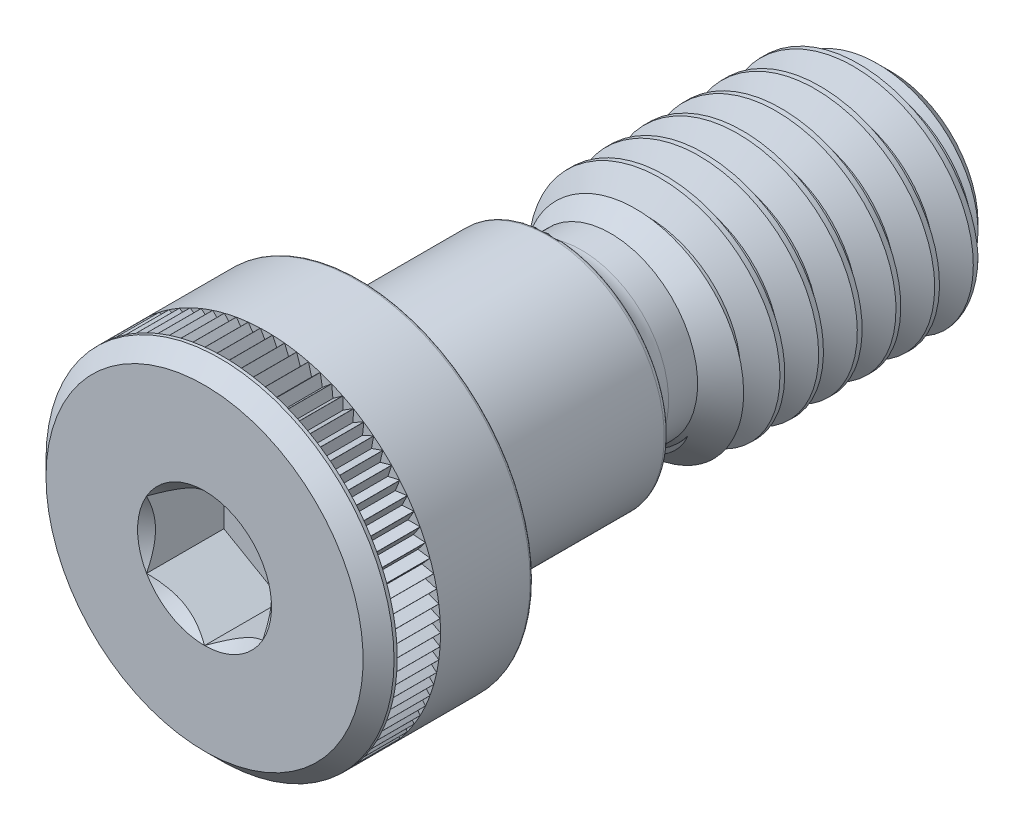
from build123d import *

# Parameters (mm, degrees)
CUT_EXTRUDE2_DEPTH = 3.175
CUT_SWEEP1_PITCH   = 1.5875
CUT_EXTRUDE5_DEPTH = 1.778
CIRPATTERN1_COUNT  = 90


with BuildPart() as part:
    # Sketch12 → Revolve1 (revolve)
    with BuildSketch(Plane(origin=(0, 0, 0), x_dir=(0, 0, -1), z_dir=(1, 0, 0)), mode=Mode.PRIVATE) as revolve1_sk:
        with BuildLine():
            Line((-14.0890625, 0), (-14.0890625, 6.50875))
            Line((-14.0890625, 6.50875), (-13.4540625, 7.14375))
            Line((-13.4540625, 7.14375), (-7.8660625, 7.14375))
            ThreePointArc((-7.8660625, 7.14375), (-7.776259939, 7.106552561), (-7.7390625, 7.01675))
            Line((-7.7390625, 7.01675), (-7.7390625, 4.429125))
            Line((-7.7390625, 4.429125), (-6.9453125, 4.429125))
            Line((-6.9453125, 4.429125), (-6.9453125, 4.572))
            ThreePointArc((-6.9453125, 4.572), (-6.889516342, 4.706703842), (-6.7548125, 4.7625))
            Line((-6.7548125, 4.7625), (0.02113852, 4.7625))
            ThreePointArc((0.02113852, 4.7625), (0.146207897, 4.715693775), (0.209817689, 4.598275862))
            ThreePointArc((0.209817689, 4.598275862), (0.607378892, 3.864413909), (1.3890625, 3.571875))
            Line((1.3890625, 3.571875), (2.5796875, 3.571875))
            Line((2.5796875, 3.571875), (3.7703125, 4.7625))
            Line((3.7703125, 4.7625), (12.8984375, 4.7625))
            Line((12.8984375, 4.7625), (14.0890625, 3.571875))
            Line((14.0890625, 3.571875), (14.0890625, 0))
            Line((14.0890625, 0), (-14.0890625, 0))
        make_face()
    revolve(revolve1_sk.sketch.rotate(Axis((0, 0, -14.0890625), (0, 0, 1)), 90), axis=Axis((0, 0, -14.0890625), (0, 0, 1)))

    # Sketch8 → Cut-Extrude2 (cut)
    with BuildSketch(Plane.XY.offset(14.0890625)):
        Polygon((0, -2.749630657), (2.38125, -1.374815329), (2.38125, 1.374815329), (0, 2.749630657), (-2.38125, 1.374815329), (-2.38125, -1.374815329), align=None)
    extrude(amount=-CUT_EXTRUDE2_DEPTH, mode=Mode.SUBTRACT)

    # Cut-Extrude4 cone 1 section (through the dimple's axis) → Cut-Extrude4 (revolve, cut)
    with BuildSketch(Plane(origin=(0, 0, 14.0890625), x_dir=(0, -1, 0), z_dir=(1, 0, 0))):
        Polygon((0, 0), (2.749630657, 0), (0, 2.749630657), align=None)
    revolve(axis=Axis((0, 0, 14.0890625), (0, 0, -1)), mode=Mode.SUBTRACT)


with BuildPart() as body_2:
    # Split1: the piece on the far side of the plane
    add(part.part)
    split(bisect_by=Plane(origin=(0, 0, -2.5796875), x_dir=(0, -1, 0), z_dir=(0, 0, -1)), keep=Keep.BOTTOM)


with BuildPart() as part_1:
    add(part.part)

    # Split1
    split(bisect_by=Plane(origin=(0, 0, -2.5796875), x_dir=(0, -1, 0), z_dir=(0, 0, -1)), keep=Keep.TOP)

    # Cut-Sweep1: the profile of Sketch13 screwed along a right-hand helix of 8 turns, 8 arcs to a turn; built about Z, then put on its axis
    cut_sweep1_z = Axis((0, 0, 0), (0, 0, 1))
    cut_sweep1_corners = [(4.848425958, 0, 0.049609375), (4.848425958, 0, -1.438671875), (3.731388504, 0, -0.79375), (3.731388504, 0, -0.5953125)]
    with BuildLine(mode=Mode.PRIVATE) as cut_sweep1_profile:
        Line(cut_sweep1_corners[0], cut_sweep1_corners[1])
        Line(cut_sweep1_corners[1], cut_sweep1_corners[2])
        Line(cut_sweep1_corners[2], cut_sweep1_corners[3])
        Line(cut_sweep1_corners[3], cut_sweep1_corners[0])
    cut_sweep1_cap = Face(cut_sweep1_profile.wire())
    cut_sweep1_turn_angles = [0, 22.5, 45, 67.5, 90, 112.5, 135, 157.5, 180, 202.5, 225, 247.5, 270, 292.5, 315, 337.5, 360]
    cut_sweep1_turn_weights = [1, 0.9238795325112867, 1, 0.9238795325112867, 1, 0.9238795325112867, 1, 0.9238795325112867, 1, 0.9238795325112867, 1, 0.9238795325112867, 1, 0.9238795325112867, 1, 0.9238795325112867, 1]
    cut_sweep1_turn_rails = [Edge.make_bspline([Vector(p[0], p[1], 0).rotate(cut_sweep1_z, cut_sweep1_turn_angles[k]) / cut_sweep1_turn_weights[k] + Vector(0, 0, p[2] + CUT_SWEEP1_PITCH * cut_sweep1_turn_angles[k] / 360) for k in range(17)], [0, 0, 0, 1, 1, 2, 2, 3, 3, 4, 4, 5, 5, 6, 6, 7, 7, 8, 8, 8], 2, cut_sweep1_turn_weights) for p in cut_sweep1_corners]
    cut_sweep1_turn_sides = [Face.make_surface_from_curves(cut_sweep1_turn_rails[p[0]], cut_sweep1_turn_rails[p[1]]) for p in [(0, 1), (1, 2), (2, 3), (3, 0)]]
    cut_sweep1 = Plane(origin=(0, 0, -14.0890625), x_dir=(0, 1, 0), z_dir=(0, 0, 1)) * Solid(Shell([*[p.moved(Location((0, 0, CUT_SWEEP1_PITCH * i))) for i in range(8) for p in cut_sweep1_turn_sides], cut_sweep1_cap, cut_sweep1_cap.rotate(cut_sweep1_z, 2880).moved(Location((0, 0, CUT_SWEEP1_PITCH * 2880 / 360)))]))
    add(cut_sweep1, mode=Mode.SUBTRACT)


with BuildPart() as body_2_1:
    add(body_2.part)

    # Combine1: union part
    add(part_1.part)

    # Sketch11 → Cut-Extrude5 (cut)
    with BuildSketch(Plane.XY.offset(13.3270625)):
        Polygon((0.249465247, 7.14375), (0, 6.711663517), (-0.249465247, 7.14375), align=None)
    cut_extrude5 = extrude(amount=-CUT_EXTRUDE5_DEPTH, mode=Mode.SUBTRACT)

    # CirPattern1: Cut-Extrude5 ×90 about axis
    cirpattern1_axis = Axis((0, 0, 0), (0, 0, 1))
    for i in range(1, CIRPATTERN1_COUNT):
        add(cut_extrude5.rotate(cirpattern1_axis, i * 360 / CIRPATTERN1_COUNT), mode=Mode.SUBTRACT)


solid = body_2_1.part
